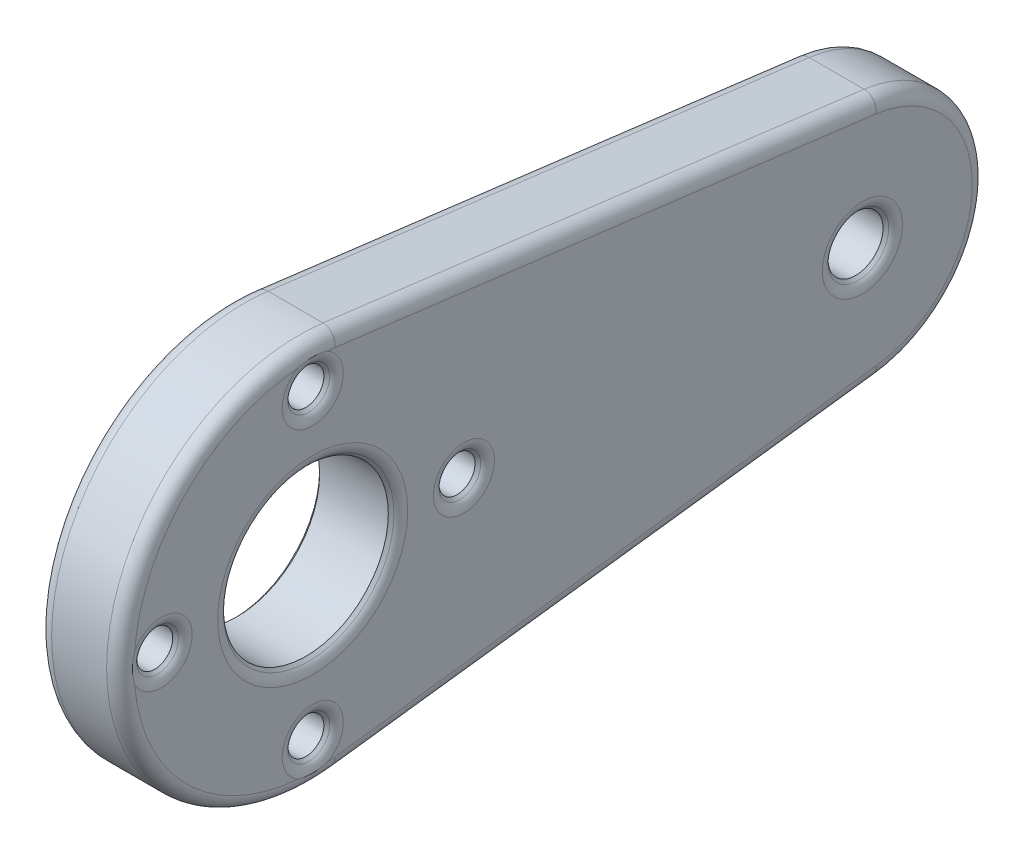
from build123d import *

# Parameters (mm, degrees)
EXTRUDE_1_DEPTH      = 6
SKETCH_2_OUTSIDE_W   = 78.84
SKETCH_2_OUTSIDE_H   = 43.84
SKETCH_2_OUTSIDE_R   = 6
SKETCH_2_OUTSIDE_R_2 = 1.310775321
SKETCH_2_OUTSIDE_R_3 = 2
CUT_EXTRUDE_1_DEPTH  = 52.312766443
CHAMFER_1_SIZE       = 0.5
FILLET_1_R           = 1


with BuildPart() as part:
    # 草图1 → 凸台-拉伸1 (new body)
    with BuildSketch(Plane(origin=(0, 0, 0), x_dir=(0, 0, -1), z_dir=(1, 0, 0))):
        with BuildLine():
            Line((41.125, 8.929410675), (1.75, 13.890194383))
            ThreePointArc((1.75, 13.890194383), (-14, 0), (1.75, -13.890194383))
            Line((1.75, -13.890194383), (41.125, -8.929410675))
            ThreePointArc((41.125, -8.929410675), (49, 0), (41.125, 8.929410675))
        make_face()
    extrude(amount=EXTRUDE_1_DEPTH)

    # 草图2 outside → 切除-拉伸1 (cut, through all)
    # profile 1 of 7: a face of its own
    with BuildSketch(Plane.ZY):
        with Locations((-17.5, 0)):
            Rectangle(SKETCH_2_OUTSIDE_W, SKETCH_2_OUTSIDE_H)
        with BuildLine():
            Line((-41.125, -8.929410675), (-1.75, -13.890194383))
            ThreePointArc((-1.75, -13.890194383), (14, 0), (-1.75, 13.890194383))
            Line((-1.75, 13.890194383), (-41.125, 8.929410675))
            ThreePointArc((-41.125, 8.929410675), (-49, 0), (-41.125, -8.929410675))
        make_face(mode=Mode.SUBTRACT)
    # profile 2 of 7: a face of its own
    with BuildSketch(Plane.ZY):
        Circle(SKETCH_2_OUTSIDE_R)
    # profile 3 of 7: a face of its own
    with BuildSketch(Plane.ZY):
        with Locations((11, 0)):
            Circle(SKETCH_2_OUTSIDE_R_2)
    # profile 4 of 7: a face of its own
    with BuildSketch(Plane.ZY):
        with Locations((0, -11)):
            Circle(SKETCH_2_OUTSIDE_R_2)
    # profile 5 of 7: a face of its own
    with BuildSketch(Plane.ZY):
        with Locations((-11, 0)):
            Circle(SKETCH_2_OUTSIDE_R_2)
    # profile 6 of 7: a face of its own
    with BuildSketch(Plane.ZY):
        with Locations((0, 11)):
            Circle(SKETCH_2_OUTSIDE_R_2)
    # profile 7 of 7: a face of its own
    with BuildSketch(Plane.ZY):
        with Locations((-40, 0)):
            Circle(SKETCH_2_OUTSIDE_R_3)
    extrude(amount=-CUT_EXTRUDE_1_DEPTH, mode=Mode.SUBTRACT)

    # 倒角1
    chamfer_1_edges = [part.edges().sort_by_distance(p)[0] for p in [
        (6, 11, -1.310775321),
        (0, 11, -1.310775321),
        (6, 0, -12.310775321),
        (0, 0, -12.310775321),
        (6, -11, -1.310775321),
        (0, -11, -1.310775321),
        (6, 0, 9.689224679),
        (0, 0, 9.689224679),
        (6, 0, -42),
        (0, 0, -42),
        (6, 0, -6),
        (0, 0, -6),
    ]]
    chamfer(chamfer_1_edges, length=CHAMFER_1_SIZE)

    # 圆角1
    # the kernel refuses this fillet: 1 mm, written as the material it takes off along each edge
    with BuildSketch(Plane(origin=(6, 0, -40), x_dir=(0, -0.9921567416492214, -0.125), z_dir=(0, -0.125, 0.9921567416492214))) as fillet_1_piece_1:
        with BuildLine():
            CenterArc((9 - FILLET_1_R, -FILLET_1_R), FILLET_1_R, 0, 90)
            Line((9 - FILLET_1_R, 0), (9, 0))
            Line((9, 0), (9, -FILLET_1_R))
        make_face()
    revolve(axis=Axis((6, 0, -40), (1, 0, 0)), revolution_arc=165.638488437, mode=Mode.SUBTRACT)
    with BuildSketch(Plane(origin=(6, 8.929410675, -41.125), x_dir=(-1, 0, 0), z_dir=(0, 0.12499999999999993, 0.9921567416492215)), Plane(origin=(6, -13.890194383, -1.75), x_dir=(-1, 0, 0), z_dir=(0, 0.12500000000000006, -0.9921567416492215)), Plane(origin=(0, 8.929410675, -41.125), x_dir=(0, -0.9921567416492216, 0.12499999999999994), z_dir=(0, 0.12499999999999993, 0.9921567416492215)), Plane(origin=(0, -13.890194383, -1.75), x_dir=(0, 0.9921567416492215, 0.12500000000000006), z_dir=(0, 0.12500000000000006, -0.9921567416492215))) as fillet_1_piece_2:
        with BuildLine():
            CenterArc((FILLET_1_R, FILLET_1_R), FILLET_1_R, 180, 90)
            Line((0, FILLET_1_R), (0, 0))
            Line((0, 0), (FILLET_1_R, 0))
        make_face()
    extrude(amount=39.686269666, mode=Mode.SUBTRACT)
    with BuildSketch(Plane(origin=(6, 0, 0), x_dir=(0, 0.9921567416492215, -0.12500000000000014), z_dir=(0, -0.12500000000000014, -0.9921567416492215))) as fillet_1_piece_3:
        with BuildLine():
            CenterArc((14 - FILLET_1_R, -FILLET_1_R), FILLET_1_R, 0, 90)
            Line((14 - FILLET_1_R, 0), (14, 0))
            Line((14, 0), (14, -FILLET_1_R))
        make_face()
    revolve(axis=Axis((6, 0, 0), (1, 0, 0)), revolution_arc=194.361511563, mode=Mode.SUBTRACT)
    with BuildSketch(Plane(origin=(0, 0, 0), x_dir=(0, 0.9921567416492215, -0.12500000000000014), z_dir=(0, -0.12500000000000014, -0.9921567416492215))) as fillet_1_piece_4:
        with BuildLine():
            CenterArc((14 - FILLET_1_R, FILLET_1_R), FILLET_1_R, 270, 90)
            Line((14, FILLET_1_R), (14, 0))
            Line((14, 0), (14 - FILLET_1_R, 0))
        make_face()
    revolve(axis=Axis((0, 0, 0), (1, 0, 0)), revolution_arc=194.361511563, mode=Mode.SUBTRACT)
    with BuildSketch(Plane(origin=(0, 0, -40), x_dir=(0, 0, 1), z_dir=(0, -1, 0))) as fillet_1_piece_5:
        with BuildLine():
            CenterArc((2.5 + FILLET_1_R * 0.414213562373, -FILLET_1_R), FILLET_1_R, 90, 45)
            Line((2.5 - FILLET_1_R * 0.292893218813, -FILLET_1_R * 0.292893218813), (2.5, 0))
            Line((2.5, 0), (2.5 + FILLET_1_R * 0.414213562373, 0))
        make_face()
    revolve(axis=Axis((0, 0, -40), (-1, 0, 0)), mode=Mode.SUBTRACT)
    with BuildSketch(Plane(origin=(0, 0, -11), x_dir=(0, 0, 1), z_dir=(0, -1, 0))) as fillet_1_piece_6:
        with BuildLine():
            CenterArc((1.810775321 + FILLET_1_R * 0.414213562373, -FILLET_1_R), FILLET_1_R, 90, 45)
            Line((1.810775321 - FILLET_1_R * 0.292893218813, -FILLET_1_R * 0.292893218813), (1.810775321, 0))
            Line((1.810775321, 0), (1.810775321 + FILLET_1_R * 0.414213562373, 0))
        make_face()
    revolve(axis=Axis((0, 0, -11), (-1, 0, 0)), mode=Mode.SUBTRACT)
    with BuildSketch(Plane(origin=(0, 0, 0), x_dir=(0, 0, 1), z_dir=(0, -1, 0))) as fillet_1_piece_7:
        with BuildLine():
            CenterArc((6.5 + FILLET_1_R * 0.414213562373, -FILLET_1_R), FILLET_1_R, 90, 45)
            Line((6.5 - FILLET_1_R * 0.292893218813, -FILLET_1_R * 0.292893218813), (6.5, 0))
            Line((6.5, 0), (6.5 + FILLET_1_R * 0.414213562373, 0))
        make_face()
    revolve(axis=Axis((0, 0, 0), (-1, 0, 0)), mode=Mode.SUBTRACT)
    with BuildSketch(Plane(origin=(0, 11, 0), x_dir=(0, 0, 1), z_dir=(0, -1, 0))) as fillet_1_piece_8:
        with BuildLine():
            CenterArc((1.810775321 + FILLET_1_R * 0.414213562373, -FILLET_1_R), FILLET_1_R, 90, 45)
            Line((1.810775321 - FILLET_1_R * 0.292893218813, -FILLET_1_R * 0.292893218813), (1.810775321, 0))
            Line((1.810775321, 0), (1.810775321 + FILLET_1_R * 0.414213562373, 0))
        make_face()
    revolve(axis=Axis((0, 11, 0), (-1, 0, 0)), mode=Mode.SUBTRACT)
    with BuildSketch(Plane(origin=(0, -11, 0), x_dir=(0, 0, 1), z_dir=(0, -1, 0))) as fillet_1_piece_9:
        with BuildLine():
            CenterArc((1.810775321 + FILLET_1_R * 0.414213562373, -FILLET_1_R), FILLET_1_R, 90, 45)
            Line((1.810775321 - FILLET_1_R * 0.292893218813, -FILLET_1_R * 0.292893218813), (1.810775321, 0))
            Line((1.810775321, 0), (1.810775321 + FILLET_1_R * 0.414213562373, 0))
        make_face()
    revolve(axis=Axis((0, -11, 0), (-1, 0, 0)), mode=Mode.SUBTRACT)
    with BuildSketch(Plane(origin=(0, 0, 11), x_dir=(0, 0, 1), z_dir=(0, -1, 0))) as fillet_1_piece_10:
        with BuildLine():
            CenterArc((1.810775321 + FILLET_1_R * 0.414213562373, -FILLET_1_R), FILLET_1_R, 90, 45)
            Line((1.810775321 - FILLET_1_R * 0.292893218813, -FILLET_1_R * 0.292893218813), (1.810775321, 0))
            Line((1.810775321, 0), (1.810775321 + FILLET_1_R * 0.414213562373, 0))
        make_face()
    revolve(axis=Axis((0, 0, 11), (-1, 0, 0)), mode=Mode.SUBTRACT)
    with BuildSketch(Plane(origin=(6, 0, -40), x_dir=(0, 0, 1), z_dir=(0, -1, 0))) as fillet_1_piece_11:
        with BuildLine():
            CenterArc((2.5 + FILLET_1_R * 0.414213562373, FILLET_1_R), FILLET_1_R, 225, 45)
            Line((2.5 - FILLET_1_R * 0.292893218813, FILLET_1_R * 0.292893218813), (2.5, 0))
            Line((2.5, 0), (2.5 + FILLET_1_R * 0.414213562373, 0))
        make_face()
    revolve(axis=Axis((6, 0, -40), (-1, 0, 0)), mode=Mode.SUBTRACT)
    with BuildSketch(Plane(origin=(6, 0, -11), x_dir=(0, 0, 1), z_dir=(0, -1, 0))) as fillet_1_piece_12:
        with BuildLine():
            CenterArc((1.810775321 + FILLET_1_R * 0.414213562373, FILLET_1_R), FILLET_1_R, 225, 45)
            Line((1.810775321 - FILLET_1_R * 0.292893218813, FILLET_1_R * 0.292893218813), (1.810775321, 0))
            Line((1.810775321, 0), (1.810775321 + FILLET_1_R * 0.414213562373, 0))
        make_face()
    revolve(axis=Axis((6, 0, -11), (-1, 0, 0)), mode=Mode.SUBTRACT)
    with BuildSketch(Plane(origin=(6, 0, 0), x_dir=(0, 0, 1), z_dir=(0, -1, 0))) as fillet_1_piece_13:
        with BuildLine():
            CenterArc((6.5 + FILLET_1_R * 0.414213562373, FILLET_1_R), FILLET_1_R, 225, 45)
            Line((6.5 - FILLET_1_R * 0.292893218813, FILLET_1_R * 0.292893218813), (6.5, 0))
            Line((6.5, 0), (6.5 + FILLET_1_R * 0.414213562373, 0))
        make_face()
    revolve(axis=Axis((6, 0, 0), (-1, 0, 0)), mode=Mode.SUBTRACT)
    with BuildSketch(Plane(origin=(6, 11, 0), x_dir=(0, 0, 1), z_dir=(0, -1, 0))) as fillet_1_piece_14:
        with BuildLine():
            CenterArc((1.810775321 + FILLET_1_R * 0.414213562373, FILLET_1_R), FILLET_1_R, 225, 45)
            Line((1.810775321 - FILLET_1_R * 0.292893218813, FILLET_1_R * 0.292893218813), (1.810775321, 0))
            Line((1.810775321, 0), (1.810775321 + FILLET_1_R * 0.414213562373, 0))
        make_face()
    revolve(axis=Axis((6, 11, 0), (-1, 0, 0)), mode=Mode.SUBTRACT)
    with BuildSketch(Plane(origin=(6, -11, 0), x_dir=(0, 0, 1), z_dir=(0, -1, 0))) as fillet_1_piece_15:
        with BuildLine():
            CenterArc((1.810775321 + FILLET_1_R * 0.414213562373, FILLET_1_R), FILLET_1_R, 225, 45)
            Line((1.810775321 - FILLET_1_R * 0.292893218813, FILLET_1_R * 0.292893218813), (1.810775321, 0))
            Line((1.810775321, 0), (1.810775321 + FILLET_1_R * 0.414213562373, 0))
        make_face()
    revolve(axis=Axis((6, -11, 0), (-1, 0, 0)), mode=Mode.SUBTRACT)
    with BuildSketch(Plane(origin=(6, 0, 11), x_dir=(0, 0, 1), z_dir=(0, -1, 0))) as fillet_1_piece_16:
        with BuildLine():
            CenterArc((1.810775321 + FILLET_1_R * 0.414213562373, FILLET_1_R), FILLET_1_R, 225, 45)
            Line((1.810775321 - FILLET_1_R * 0.292893218813, FILLET_1_R * 0.292893218813), (1.810775321, 0))
            Line((1.810775321, 0), (1.810775321 + FILLET_1_R * 0.414213562373, 0))
        make_face()
    revolve(axis=Axis((6, 0, 11), (-1, 0, 0)), mode=Mode.SUBTRACT)
    with BuildSketch(Plane(origin=(0, 0, -40), x_dir=(0, -0.9921567416492214, -0.125), z_dir=(0, -0.125, 0.9921567416492214))) as fillet_1_piece_17:
        with BuildLine():
            CenterArc((9 - FILLET_1_R, FILLET_1_R), FILLET_1_R, 270, 90)
            Line((9, FILLET_1_R), (9, 0))
            Line((9, 0), (9 - FILLET_1_R, 0))
        make_face()
    revolve(axis=Axis((0, 0, -40), (1, 0, 0)), revolution_arc=165.638488437, mode=Mode.SUBTRACT)


solid = part.part
